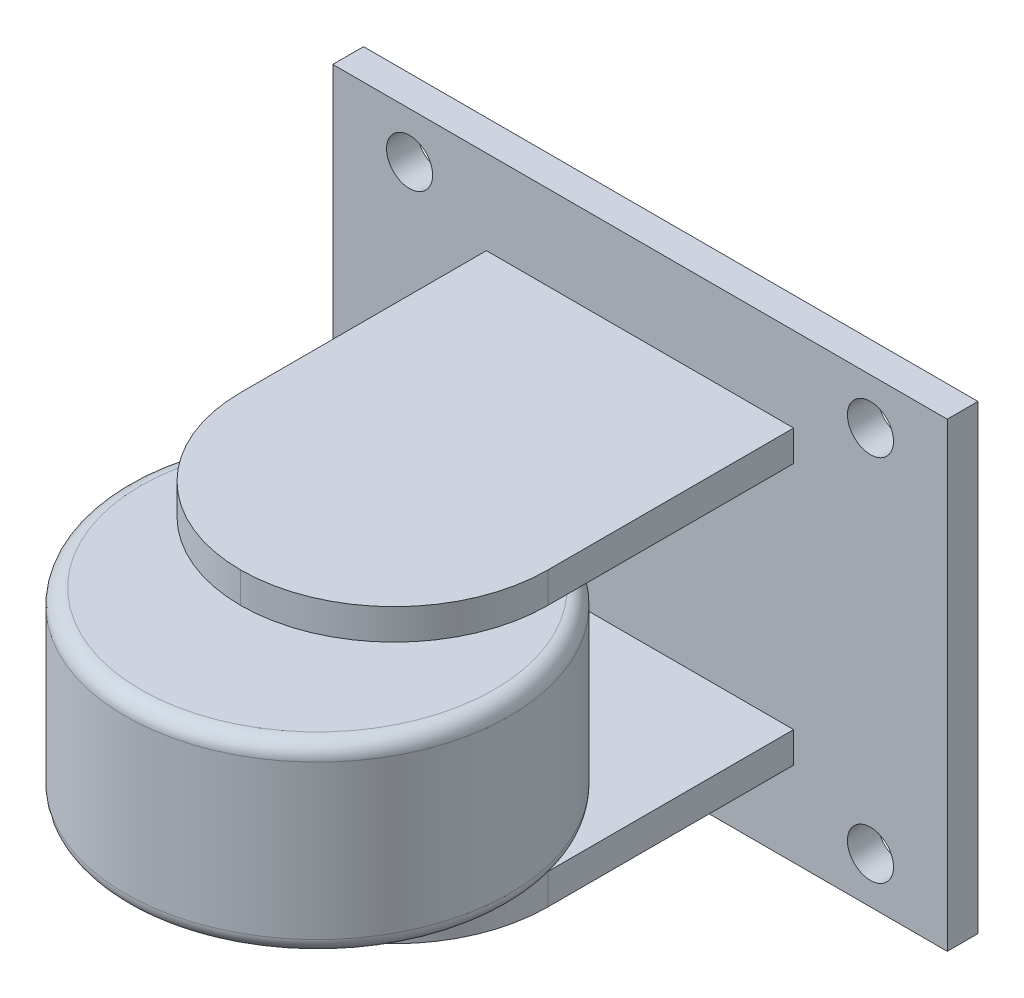
from build123d import *

# Parameters (mm, degrees)
SKETCH1_W                = 40
SKETCH1_H                = 30
BOSS_EXTRUDE1_DEPTH      = 2
SKETCH2_R                = 1.5
CUT_EXTRUDE1_DEPTH       = 26.079872408
SKETCH3_W                = 20
SKETCH3_H                = 2
BOSS_EXTRUDE2_DEPTH      = 26
SKETCH4_R                = 2.5
BOSS_EXTRUDE3_DEPTH      = 19
BOSS_EXTRUDE4_DEPTH      = 6
BOSS_EXTRUDE4_DEPTH_BACK = 6
SKETCH5_R                = 12.5
FILLET1_R                = 10
FILLET2_R                = 1


with BuildPart() as part:
    # Sketch1 → Boss-Extrude1 (new body)
    with BuildSketch(Plane.XY):
        Rectangle(SKETCH1_W, SKETCH1_H)
    extrude(amount=BOSS_EXTRUDE1_DEPTH)

    # Sketch2 → Cut-Extrude1 (cut, through all)
    with BuildSketch(Plane.XY.offset(2)):
        with Locations((-15, 12)):
            Circle(SKETCH2_R)
        with Locations((15, 12)):
            Circle(SKETCH2_R)
        with Locations((15, -12)):
            Circle(SKETCH2_R)
        with Locations((-15, -12)):
            Circle(SKETCH2_R)
    extrude(amount=-CUT_EXTRUDE1_DEPTH, mode=Mode.SUBTRACT)

    # Sketch3 → Boss-Extrude2 (add)
    with BuildSketch(Plane.XY.offset(2)):
        with Locations((0, -8.5)):
            Rectangle(SKETCH3_W, SKETCH3_H)
        with Locations((0, 8.5)):
            Rectangle(SKETCH3_W, SKETCH3_H)
    extrude(amount=BOSS_EXTRUDE2_DEPTH)

    # Sketch4 → Boss-Extrude3 (add)
    with BuildSketch(Plane(origin=(0, 9.5, 0), x_dir=(1, 0, 0), z_dir=(0, 1, 0))):
        with Locations(Location((0, -23, 0), (0, 0, 270))):
            Circle(SKETCH4_R)
    extrude(amount=-BOSS_EXTRUDE3_DEPTH)

    # Sketch5 → Boss-Extrude4 (add, two sides: drawn at the far end of the back side and taken through both)
    with BuildSketch(Plane(origin=(0, 0, 0), x_dir=(-1, 0, 0), z_dir=(0, -1, 0)).offset(-BOSS_EXTRUDE4_DEPTH_BACK)):
        with Locations(Location((0, -23, 0), (0, 0, 90))):
            Circle(SKETCH5_R)
    extrude(amount=BOSS_EXTRUDE4_DEPTH + BOSS_EXTRUDE4_DEPTH_BACK)

    # Fillet1
    fillet1_edges = [part.edges().sort_by_distance(p)[0] for p in [
        (10, -8.5, 28),
        (-10, -8.5, 28),
        (10, 8.5, 28),
        (-10, 8.5, 28),
    ]]
    fillet(fillet1_edges, radius=FILLET1_R - 0.0001)  # a hair under: the kernel refuses the full size

    # Fillet2
    fillet2_edges = [part.edges().sort_by_distance(p)[0] for p in [
        (0, 6, 35.5),
        (0, -6, 35.5),
    ]]
    fillet(fillet2_edges, radius=FILLET2_R)


solid = part.part
